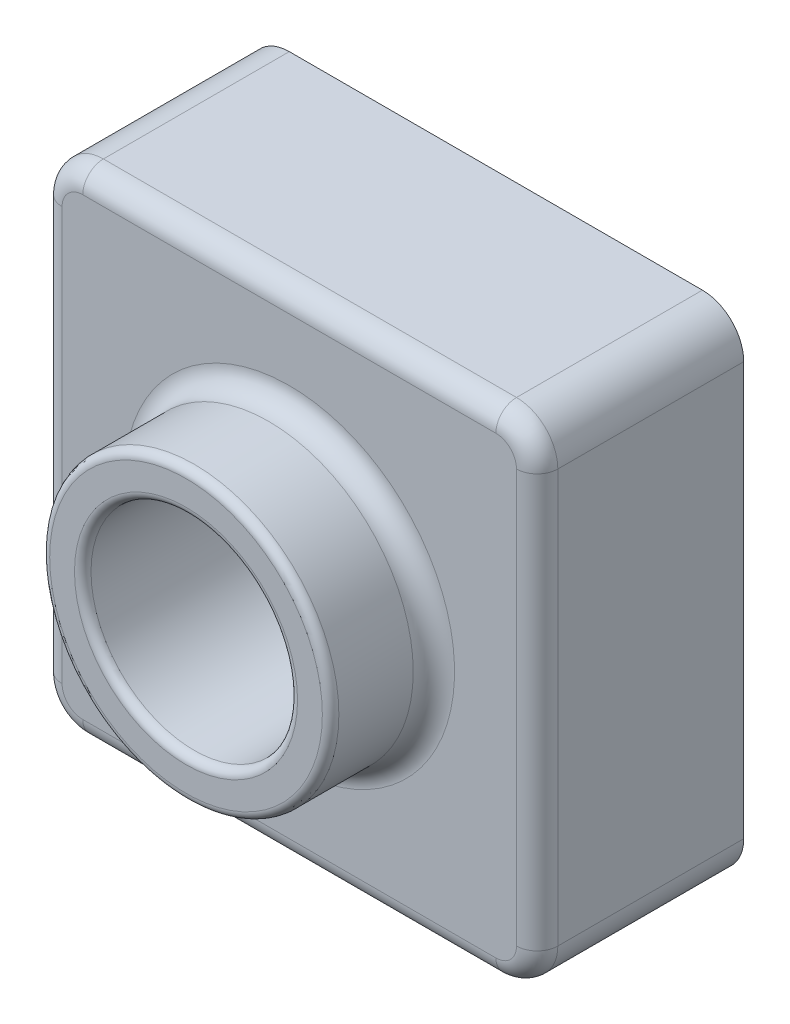
from build123d import *

# Parameters (mm, degrees)
SKETCH1_W          = 120
SKETCH1_H          = 120
EXTRUDE1_DEPTH     = 50
SKETCH2_R          = 35
EXTRUDE2_DEPTH     = 25
SKETCH3_R          = 25
CUT_EXTRUDE1_DEPTH = 186.539753153
FILLET1_R          = 10
FILLET2_R          = 5
FILLET3_R          = 2
SHELL1_T           = -2


with BuildPart() as part:
    # Sketch1 → Extrude1 (new body)
    with BuildSketch(Plane.XY):
        with Locations((60, 60)):
            Rectangle(SKETCH1_W, SKETCH1_H)
    extrude(amount=EXTRUDE1_DEPTH)

    # Sketch2 → Extrude2 (add)
    with BuildSketch(Plane.XY.offset(50)):
        with Locations(Location((60, 60, 0), (0, 0, 180))):
            Circle(SKETCH2_R)
    extrude(amount=EXTRUDE2_DEPTH)

    # Sketch3 → Cut-Extrude1 (cut, through all)
    with BuildSketch(Plane.XY.offset(75)):
        with Locations((60, 60)):
            Circle(SKETCH3_R)
    extrude(amount=-CUT_EXTRUDE1_DEPTH, mode=Mode.SUBTRACT)

    # Fillet1
    fillet1_edges = [part.edges().sort_by_distance(p)[0] for p in [
        (0, 120, 25),
        (120, 120, 25),
        (120, 0, 25),
        (0, 0, 25),
    ]]
    fillet(fillet1_edges, radius=FILLET1_R)

    # Fillet2
    fillet2_edges = [part.edges().sort_by_distance(p)[0] for p in [
        (95, 60, 50),
        (0, 60, 50),
        (60, 120, 50),
        (60, 0, 50),
        (120, 60, 50),
        (2.928932188, 2.928932188, 50),
        (117.071067812, 2.928932188, 50),
        (117.071067812, 117.071067812, 50),
        (2.928932188, 117.071067812, 50),
    ]]
    fillet(fillet2_edges, radius=FILLET2_R)

    # Fillet3
    fillet3_edges = [part.edges().sort_by_distance(p)[0] for p in [
        (95, 60, 75),
        (35, 60, 75),
    ]]
    fillet(fillet3_edges, radius=FILLET3_R)

    # Shell1
    shell1_openings = [part.faces().sort_by_distance(p)[0] for p in [
        (60, 1.697056275, 0),
    ]]
    offset(amount=SHELL1_T, openings=shell1_openings, kind=Kind.INTERSECTION)


solid = part.part
